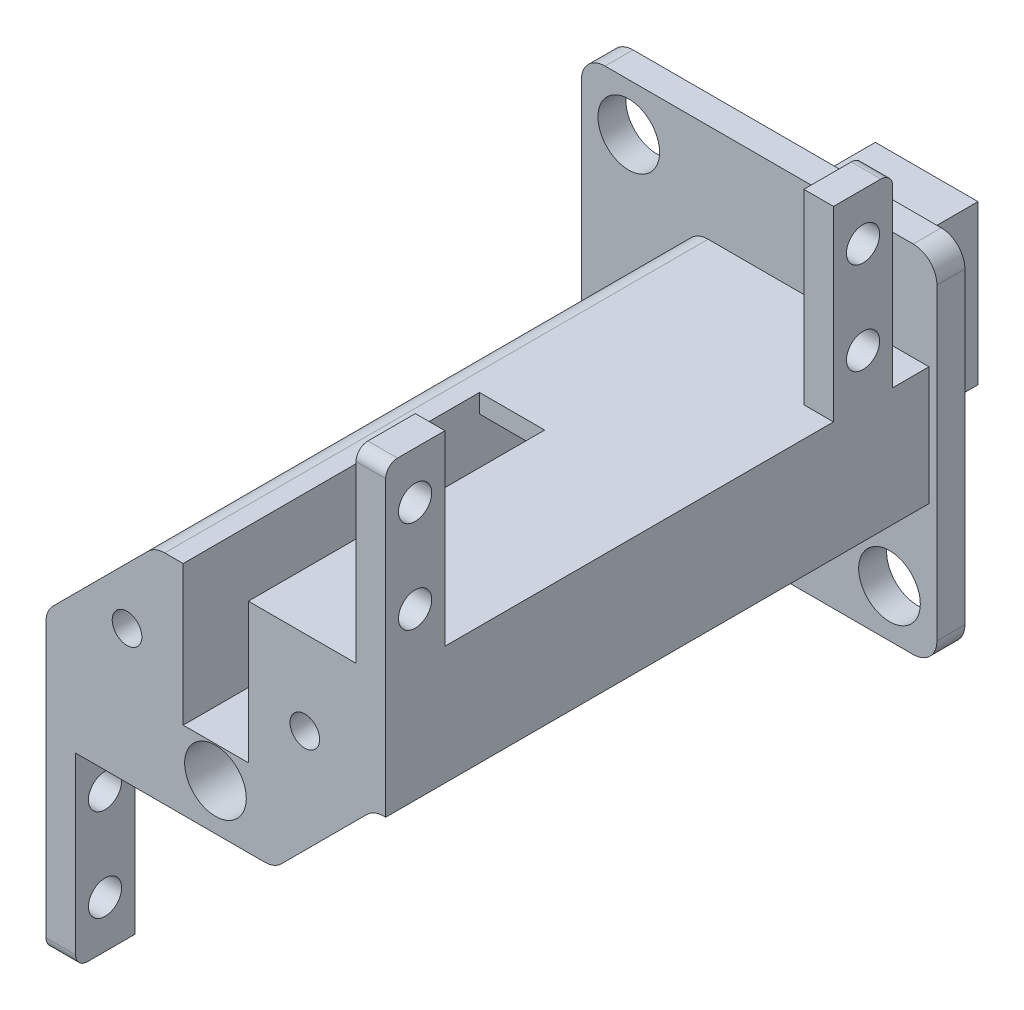
from build123d import *

# Parameters (mm, degrees)
SKETCH1_W           = 11
SKETCH1_H           = 17
SKETCH1_W_2         = 7
SKETCH1_H_2         = 13
BOSS_EXTRUDE1_DEPTH = 76.2
SKETCH2_W           = 11
SKETCH2_H           = 17
BOSS_EXTRUDE2_DEPTH = 2
SKETCH3_W           = 7
SKETCH3_H           = 11
CUT_EXTRUDE1_DEPTH  = 2
SKETCH4_W           = 38.1
SKETCH4_H           = 38.1
SKETCH4_W_2         = 11
SKETCH4_H_2         = 17
BOSS_EXTRUDE3_DEPTH = 3
SKETCH5_R           = 12.7
SKETCH5_W           = 11
SKETCH5_H           = 17
BOSS_EXTRUDE4_DEPTH = 2.54
SKETCH6_W           = 11
SKETCH6_H           = 58.214
BOSS_EXTRUDE5_DEPTH = 6.35
CUT_EXTRUDE2_REACH  = 87.303
SKETCH7_R           = 3.302
SKETCH8_W           = 6.985
SKETCH8_H           = 31.75
CUT_EXTRUDE3_DEPTH  = 6.35
SKETCH9_W           = 58.42
SKETCH9_H           = 12.7
BOSS_EXTRUDE6_DEPTH = 12.7
SKETCH10_W          = 3.175
SKETCH10_H          = 58.214
BOSS_EXTRUDE7_DEPTH = 20
SKETCH11_R          = 1.778
SKETCH11_W          = 3.884096392
SKETCH11_H          = 20
CUT_EXTRUDE4_DEPTH  = 91.512682122
FILLET1_R           = 1.27
CHAMFER1_SIZE       = 11.43
FILLET3_R           = 2.54
SKETCH12_W          = 58.214
SKETCH12_H          = 11.675
BOSS_EXTRUDE8_DEPTH = 12.7
SKETCH13_W          = 3.175
SKETCH13_H          = 54.356
BOSS_EXTRUDE9_DEPTH = 20
CHAMFER3_SIZE       = 12.7
FILLET4_R           = 2.54
SKETCH14_W          = 6.096
SKETCH14_H          = 28.594092226
CUT_EXTRUDE5_DEPTH  = 6.35
SKETCH15_R          = 1.778
CUT_EXTRUDE6_DEPTH  = 91.512682122
FILLET5_R           = 1.27
SKETCH16_R          = 1.5875
CUT_EXTRUDE7_DEPTH  = 12.7
FILLET6_R           = 2.54
SKETCH17_R          = 3.302
CUT_EXTRUDE8_DEPTH  = 72.570750283
SKETCH19_W          = 11
SKETCH19_H          = 17
CUT_EXTRUDE9_DEPTH  = 2.032
SKETCH21_W          = 41.629903608
SKETCH21_H          = 20
CUT_EXTRUDE10_DEPTH = 25.4
SKETCH22_W          = 41.656
SKETCH22_H          = 20
CUT_EXTRUDE11_DEPTH = 25.4


with BuildPart() as part:
    # Sketch1 → Boss-Extrude1 (new body)
    with BuildSketch(Plane.XY):
        with Locations((3.5, 6.5)):
            Rectangle(SKETCH1_W, SKETCH1_H)
        with Locations((3.5, 6.5)):
            Rectangle(SKETCH1_W_2, SKETCH1_H_2, mode=Mode.SUBTRACT)
    extrude(amount=BOSS_EXTRUDE1_DEPTH)

    # Sketch2 → Boss-Extrude2 (add)
    with BuildSketch(Plane(origin=(0, 0, 0), x_dir=(-1, 0, 0), z_dir=(0, 0, -1))):
        with Locations((-3.5, 6.5)):
            Rectangle(SKETCH2_W, SKETCH2_H)
    extrude(amount=BOSS_EXTRUDE2_DEPTH)

    # Sketch3 → Cut-Extrude1 (cut)
    with BuildSketch(Plane(origin=(0, -2, 0), x_dir=(-1, 0, 0), z_dir=(0, -1, 0))):
        with Locations((-3.5, -5.5)):
            Rectangle(SKETCH3_W, SKETCH3_H)
    extrude(amount=-CUT_EXTRUDE1_DEPTH, mode=Mode.SUBTRACT)

    # Sketch4 → Boss-Extrude3 (add)
    with BuildSketch(Plane.XY.offset(14.986)):
        with Locations((3.5, 6.5)):
            Rectangle(SKETCH4_W, SKETCH4_H)
        with Locations((3.5, 6.5)):
            Rectangle(SKETCH4_W_2, SKETCH4_H_2, mode=Mode.SUBTRACT)
    extrude(amount=BOSS_EXTRUDE3_DEPTH)

    # Sketch5 → Boss-Extrude4 (add)
    with BuildSketch(Plane(origin=(0, 0, 14.986), x_dir=(-1, 0, 0), z_dir=(0, 0, -1))):
        with Locations(Location((-3.5, 6.5, 0), (0, 0, 180))):
            Circle(SKETCH5_R)
        with Locations((-3.5, 6.5)):
            Rectangle(SKETCH5_W, SKETCH5_H, mode=Mode.SUBTRACT)
    extrude(amount=BOSS_EXTRUDE4_DEPTH)

    # Sketch6 → Boss-Extrude5 (add)
    with BuildSketch(Plane.XZ.offset(2)):
        with Locations((3.5, 47.093)):
            Rectangle(SKETCH6_W, SKETCH6_H)
    extrude(amount=BOSS_EXTRUDE5_DEPTH)

    # Cut-Extrude2: up to this face of the body (flat: up to its plane)
    cut_extrude2_end = Plane(part.part.faces().sort_by_distance((3.5, 6.5, -2))[0])
    # Sketch7 → Cut-Extrude2 (cut, up to the picked face)
    with BuildSketch(Plane.XY.offset(76.2), mode=Mode.PRIVATE) as cut_extrude2_sk1:
        with Locations((3.461, -3.429)):
            Circle(SKETCH7_R)
    cut_extrude2_tool1 = split(extrude(cut_extrude2_sk1.sketch, amount=-CUT_EXTRUDE2_REACH, mode=Mode.PRIVATE), bisect_by=cut_extrude2_end, keep=Keep.BOTH, mode=Mode.PRIVATE)
    add(cut_extrude2_tool1.solids().sort_by(Axis((3.461, -3.429, 76.2), (0, 0, -1)))[0], mode=Mode.SUBTRACT)

    # Sketch8 → Cut-Extrude3 (cut)
    with BuildSketch(Plane(origin=(0, 15, 0), x_dir=(1, 0, 0), z_dir=(0, 1, 0))):
        with Locations((3.4925, -60.325)):
            Rectangle(SKETCH8_W, SKETCH8_H)
    extrude(amount=-CUT_EXTRUDE3_DEPTH, mode=Mode.SUBTRACT)

    # Sketch9 → Boss-Extrude6 (add)
    with BuildSketch(Plane(origin=(9, 0, 0), x_dir=(0, 0, -1), z_dir=(1, 0, 0))):
        with Locations((-46.99, 8.65)):
            Rectangle(SKETCH9_W, SKETCH9_H)
    extrude(amount=BOSS_EXTRUDE6_DEPTH)

    # Sketch10 → Boss-Extrude7 (add)
    with BuildSketch(Plane(origin=(0, 15, 0), x_dir=(1, 0, 0), z_dir=(0, 1, 0))):
        with Locations((20.1125, -47.093)):
            Rectangle(SKETCH10_W, SKETCH10_H)
    extrude(amount=BOSS_EXTRUDE7_DEPTH)

    # Sketch11 → Cut-Extrude4 (cut, through all)
    with BuildSketch(Plane.ZY.offset(-18.525)):
        with Locations((25.05, 29.95)):
            Circle(SKETCH11_R)
        with Locations((25.05, 20.05)):
            Circle(SKETCH11_R)
        with Locations((73.05, 29.95)):
            Circle(SKETCH11_R)
        with Locations((73.05, 20.05)):
            Circle(SKETCH11_R)
        with Locations((19.928048196, 25)):
            Rectangle(SKETCH11_W, SKETCH11_H)
    extrude(amount=-CUT_EXTRUDE4_DEPTH, mode=Mode.SUBTRACT)

    # Fillet1
    fillet1_edges = [part.edges().sort_by_distance(p)[0] for p in [
        (20.1125, 35, 76.2),
        (20.1125, 35, 21.870096392),
    ]]
    fillet(fillet1_edges, radius=FILLET1_R)

    # Chamfer1
    # the kernel refuses this chamfer: 11.43 mm, written as the material it adds along each edge
    with BuildSketch(Plane(origin=(9, 2.3, 17.986), x_dir=(0.9996219169112968, 0.027495876610586382, 0), z_dir=(0, 0, 1))) as chamfer1_piece_1_section:
        Polygon((CHAMFER1_SIZE * 0.999621916911, -CHAMFER1_SIZE * 0.0274958766106), (-CHAMFER1_SIZE * 0.0274958766106, -CHAMFER1_SIZE * 0.999621916911), (0, 0), align=None)
    chamfer1_piece_1 = extrude(amount=58.214, mode=Mode.PRIVATE)
    chamfer1_piece_1 = split(chamfer1_piece_1, bisect_by=Plane(origin=(13.789958752, -8.35, 47.093), z_dir=(0, 1, 0)), keep=Keep.TOP, mode=Mode.PRIVATE)
    add(chamfer1_piece_1)

    # Fillet3
    fillet3_edges = [part.edges().sort_by_distance(p)[0] for p in [
        (20.43, 2.3, 47.093),
        (9.78, -8.35, 47.093),
    ]]
    fillet(fillet3_edges, radius=FILLET3_R)

    # Sketch12 → Boss-Extrude8 (add)
    with BuildSketch(Plane.ZY.offset(2)):
        with Locations((47.093, -2.5125)):
            Rectangle(SKETCH12_W, SKETCH12_H)
    extrude(amount=BOSS_EXTRUDE8_DEPTH)

    # Sketch13 → Boss-Extrude9 (add)
    with BuildSketch(Plane.XZ.offset(8.35)):
        with Locations((-13.1125, 49.022)):
            Rectangle(SKETCH13_W, SKETCH13_H)
    extrude(amount=BOSS_EXTRUDE9_DEPTH)

    # Chamfer3
    # the kernel refuses this chamfer: 12.7 mm, written as the material it adds along each edge
    with BuildSketch(Plane(origin=(-2, 3.325, 17.986), x_dir=(0.027495876610586365, 0.9996219169112966, 0), z_dir=(0, 0, 1))) as chamfer3_piece_1_section:
        Polygon((CHAMFER3_SIZE * 0.999621916911, CHAMFER3_SIZE * 0.0274958766106), (-CHAMFER3_SIZE * 0.0274958766106, CHAMFER3_SIZE * 0.999621916911), (0, 0), align=None)
    chamfer3_piece_1 = extrude(amount=58.214, mode=Mode.PRIVATE)
    chamfer3_piece_1 = split(chamfer3_piece_1, bisect_by=Plane(origin=(-6.232956887, 15, 47.093), z_dir=(0, -1, 0)), keep=Keep.TOP, mode=Mode.PRIVATE)
    chamfer3_piece_1 = split(chamfer3_piece_1, bisect_by=Plane(origin=(-14.7, 7.408033371, 47.093), z_dir=(1, 0, 0)), keep=Keep.TOP, mode=Mode.PRIVATE)
    add(chamfer3_piece_1)

    # Fillet4
    fillet4_edges = [part.edges().sort_by_distance(p)[0] for p in [
        (-14.7, 3.325, 47.093),
        (-3.025, 15, 47.093),
    ]]
    fillet(fillet4_edges, radius=FILLET4_R)

    # Sketch14 → Cut-Extrude5 (cut)
    with BuildSketch(Plane.XZ.offset(8.35)):
        with Locations((3.647897552, 55.896932406)):
            Rectangle(SKETCH14_W, SKETCH14_H)
    extrude(amount=-CUT_EXTRUDE5_DEPTH, mode=Mode.SUBTRACT)

    # Sketch15 → Cut-Extrude6 (cut, through all)
    with BuildSketch(Plane(origin=(-11.525, 0, 0), x_dir=(0, 0, -1), z_dir=(1, 0, 0))):
        with Locations((-73.05, -13.4)):
            Circle(SKETCH15_R)
        with Locations((-73.05, -23.3)):
            Circle(SKETCH15_R)
        with Locations((-25.05, -13.4)):
            Circle(SKETCH15_R)
        with Locations((-25.05, -23.3)):
            Circle(SKETCH15_R)
    extrude(amount=-CUT_EXTRUDE6_DEPTH, mode=Mode.SUBTRACT)

    # Fillet5
    fillet5_edges = [part.edges().sort_by_distance(p)[0] for p in [
        (-13.1125, -28.35, 21.844),
        (-13.1125, -28.35, 76.2),
    ]]
    fillet(fillet5_edges, radius=FILLET5_R)

    # Sketch16 → Cut-Extrude7 (cut)
    with BuildSketch(Plane.XY.offset(76.2)):
        with Locations((-6.016625, 5.971505071)):
            Circle(SKETCH16_R)
        with Locations((13.033375, 5.971505071)):
            Circle(SKETCH16_R)
    extrude(amount=-CUT_EXTRUDE7_DEPTH, mode=Mode.SUBTRACT)

    # Fillet6
    fillet6_edges = [part.edges().sort_by_distance(p)[0] for p in [
        (-15.55, 25.55, 16.486),
        (-15.55, -12.55, 16.486),
        (22.55, -12.55, 16.486),
        (22.55, 25.55, 16.486),
    ]]
    fillet(fillet6_edges, radius=FILLET6_R)

    # Sketch17 → Cut-Extrude8 (cut, through all)
    with BuildSketch(Plane.XY.offset(17.986)):
        with Locations((-10.47, 20.47)):
            Circle(SKETCH17_R)
        with Locations((17.47, -7.47)):
            Circle(SKETCH17_R)
    extrude(amount=-CUT_EXTRUDE8_DEPTH, mode=Mode.SUBTRACT)

    # Sketch19 → Cut-Extrude9 (cut)
    with BuildSketch(Plane(origin=(0, 0, -2), x_dir=(-1, 0, 0), z_dir=(0, 0, -1))):
        with Locations((-3.5, 6.5)):
            Rectangle(SKETCH19_W, SKETCH19_H)
    extrude(amount=-CUT_EXTRUDE9_DEPTH, mode=Mode.SUBTRACT)

    # Sketch21 → Cut-Extrude10 (cut)
    with BuildSketch(Plane(origin=(21.7, 0, 0), x_dir=(0, 0, -1), z_dir=(1, 0, 0))):
        with Locations((-49.035048196, 25)):
            Rectangle(SKETCH21_W, SKETCH21_H)
    extrude(amount=-CUT_EXTRUDE10_DEPTH, mode=Mode.SUBTRACT)

    # Sketch22 → Cut-Extrude11 (cut)
    with BuildSketch(Plane.ZY.offset(14.7)):
        with Locations((49.022, -18.35)):
            Rectangle(SKETCH22_W, SKETCH22_H)
    extrude(amount=-CUT_EXTRUDE11_DEPTH, mode=Mode.SUBTRACT)


solid = part.part
